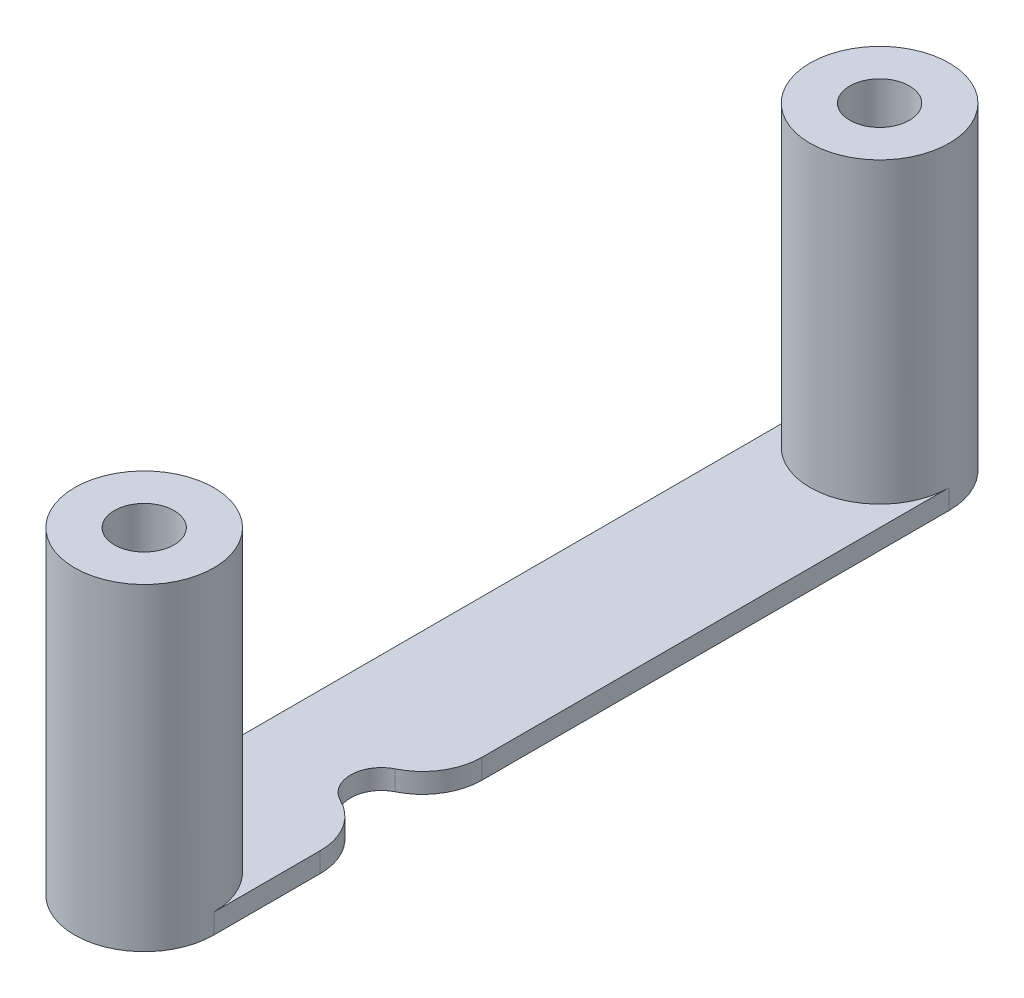
from build123d import *

# Parameters (mm, degrees)
BOSS_EXTRUDE1_DEPTH     = 1
SKETCH2_R               = 3.5
BOSS_EXTRUDE2_DEPTH     = 15
CUT_EXTRUDE3_DEPTH      = 48.339201514
CUT_EXTRUDE3_DEPTH_BACK = 48.339201514
SKETCH5_R               = 1.5
CUT_EXTRUDE4_REACH      = 49.339
SKETCH6_R               = 1.536962844
FILLET1_R               = 3


with BuildPart() as part:
    # Sketch1 → Boss-Extrude1 (new body)
    with BuildSketch(Plane(origin=(0, 0, 0), x_dir=(1, 0, 0), z_dir=(0, 1, 0))):
        with BuildLine():
            ThreePointArc((3.5, 0), (5.974873734, 1.025126266), (7, 3.5))
            Line((7, 3.5), (7, 40.5))
            ThreePointArc((7, 40.5), (3.5, 44), (0, 40.5))
            Line((0, 40.5), (0, 3.5))
            ThreePointArc((0, 3.5), (1.025126266, 1.025126266), (3.5, 0))
        make_face()
    extrude(amount=BOSS_EXTRUDE1_DEPTH)

    # Sketch2 → Boss-Extrude2 (add)
    with BuildSketch(Plane(origin=(0, 1, 0), x_dir=(1, 0, 0), z_dir=(0, 1, 0))):
        with Locations((3.5, 40.5)):
            Circle(SKETCH2_R)
        with Locations((3.5, 3.5)):
            Circle(SKETCH2_R)
    extrude(amount=BOSS_EXTRUDE2_DEPTH)

    # Sketch5 → Cut-Extrude3 (cut, two sides: drawn at the far end of the back side and taken through both)
    with BuildSketch(Plane(origin=(0, 16, 0), x_dir=(1, 0, 0), z_dir=(0, 1, 0)).offset(-CUT_EXTRUDE3_DEPTH_BACK)):
        with Locations((3.5, 3.5)):
            Circle(SKETCH5_R)
        with Locations((3.5, 40.5)):
            Circle(SKETCH5_R)
    extrude(amount=CUT_EXTRUDE3_DEPTH + CUT_EXTRUDE3_DEPTH_BACK, mode=Mode.SUBTRACT)

    # Sketch6 → Cut-Extrude4 (cut, up to next)
    with BuildSketch(Plane.XZ, mode=Mode.PRIVATE) as cut_extrude4_sk1:
        with Locations((6, -12.928)):
            Circle(SKETCH6_R)
    cut_extrude4_tool1 = extrude(cut_extrude4_sk1.sketch, amount=-CUT_EXTRUDE4_REACH, mode=Mode.PRIVATE) & part.part
    add(cut_extrude4_tool1.solids().sort_by_distance((6, 0, -12.928))[0], mode=Mode.SUBTRACT)

    # Fillet1
    fillet1_edges = [part.edges().sort_by_distance(p)[0] for p in [
        (7, 0.5, -14.095156709),
        (7, 0.5, -11.760843291),
    ]]
    fillet(fillet1_edges, radius=FILLET1_R)


solid = part.part
